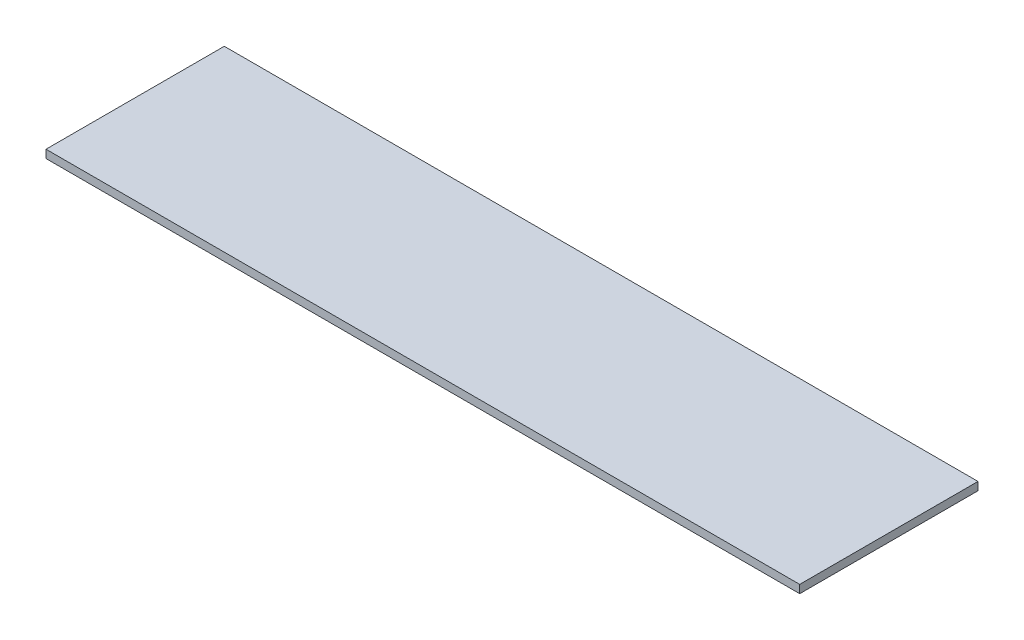
from build123d import *

# Parameters (mm, degrees)
SKETCH1_W           = 465
SKETCH1_H           = 110
BOSS_EXTRUDE1_DEPTH = 5


with BuildPart() as part:
    # Sketch1 → Boss-Extrude1 (new body)
    with BuildSketch(Plane(origin=(0, 0, 0), x_dir=(1, 0, 0), z_dir=(0, 1, 0))):
        Rectangle(SKETCH1_W, SKETCH1_H)
    extrude(amount=BOSS_EXTRUDE1_DEPTH)


solid = part.part
